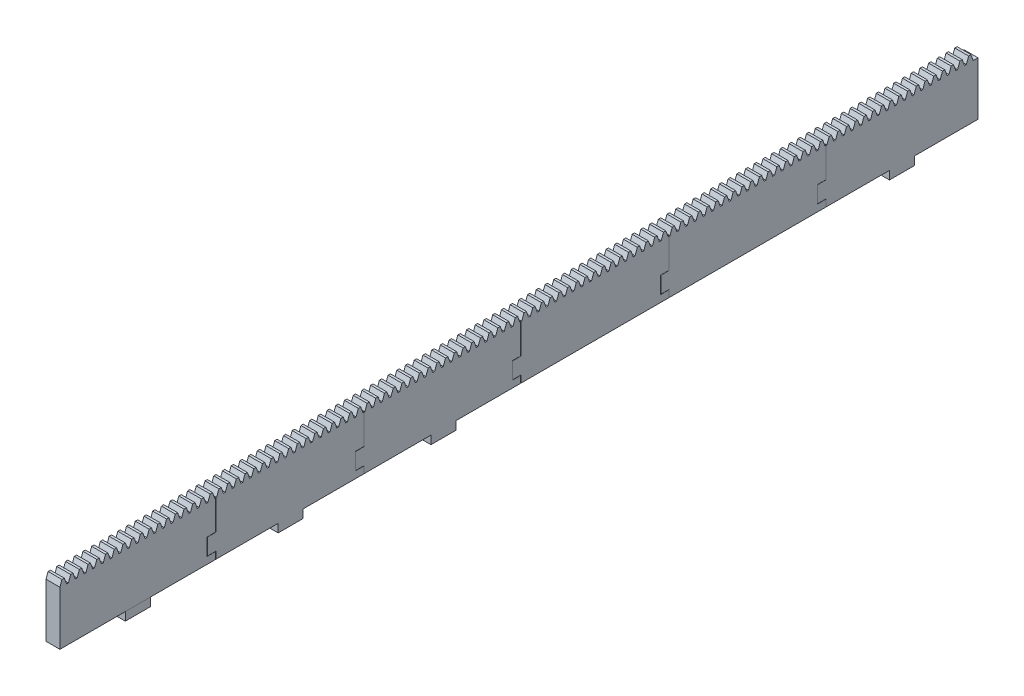
from build123d import *

# Parameters (mm, degrees)
SKETCH_2_W                  = 662
SKETCH_2_H                  = 38.37525226
EXTRUDE_1_DEPTH             = 10
EXTRUDE_2_DEPTH             = 10
PATTERN_LINEAR_1_COUNT      = 105
PATTERN_LINEAR_1_PITCH      = 6.283185307
SKETCH_8530_W               = 20
SKETCH_8530_H               = 8
EXTRUDE_8540_DEPTH          = 22
CUT_EXTRUDE_5_DEPTH         = 90936.510107105
CUT_EXTRUDE_5_DEPTH_BACK    = 90936.510107105
SKETCH_8923_R               = 2.75
CUT_EXTRUDE_5_4_3_DEPTH     = 4.3
CUT_EXTRUDE_6_DEPTH         = 90936.510107105
CUT_EXTRUDE_6_DEPTH_BACK    = 90936.510107105
CUT_EXTRUDE_0_15_DEPTH      = 90936.510107105
CUT_EXTRUDE_0_15_DEPTH_BACK = 90936.510107105
SKETCH_9619_W               = 11.96043534
SKETCH_9619_H               = 56
SKETCH_9619_W_2             = 10.15
SKETCH_5_W                  = 10
SKETCH_5_H                  = 18
EXTRUDE_6_DEPTH             = 6
PATTERN_LINEAR_2_COUNT      = 6
PATTERN_LINEAR_2_PITCH      = 110.15229715
SKETCH_6_W                  = 10
SKETCH_6_H                  = 18
EXTRUDE_7_DEPTH             = 6


with BuildPart() as part:
    # Эскиз2 → Бобышка-Вытянуть1 (new body)
    with BuildSketch(Plane(origin=(0, 0, 0), x_dir=(0, 0, -1), z_dir=(1, 0, 0))):
        with Locations((304.45000531, -90914.099555903)):
            Rectangle(SKETCH_2_W, SKETCH_2_H)
    extrude(amount=EXTRUDE_1_DEPTH)

    # Эскиз3 → Бобышка-Вытянуть2 (add)
    with BuildSketch(Plane(origin=(10, 0, 0), x_dir=(0, 0, -1), z_dir=(1, 0, 0))):
        Polygon((-26.54999469, -90894.911929773), (-24.91249469, -90890.411929773), (-23.22649469, -90890.411929773), (-21.58899469, -90894.911929773), align=None)
    extrude_2 = extrude(amount=-EXTRUDE_2_DEPTH)

    # Линейный массив1: Бобышка-Вытянуть2 ×105
    with Locations(*[(0, 0, -i * PATTERN_LINEAR_1_PITCH) for i in range(1, PATTERN_LINEAR_1_COUNT)]):
        add(extrude_2)

    # Sketch 8530 → Extrude 8540 (add)
    with BuildSketch(Plane(origin=(0, 0, 0), x_dir=(0, 0, -1), z_dir=(1, 0, 0))):
        with Locations((580.504612499, -90929.287182033)):
            Rectangle(SKETCH_8530_W, SKETCH_8530_H)
        with Locations((469.160551924, -90929.287182033)):
            Rectangle(SKETCH_8530_W, SKETCH_8530_H)
        with Locations((359.204809048, -90929.287182033)):
            Rectangle(SKETCH_8530_W, SKETCH_8530_H)
        with Locations((249.249066172, -90929.287182033)):
            Rectangle(SKETCH_8530_W, SKETCH_8530_H)
        with Locations((139.293323297, -90929.287182033)):
            Rectangle(SKETCH_8530_W, SKETCH_8530_H)
        with Locations((29.743126748, -90929.287182033)):
            Rectangle(SKETCH_8530_W, SKETCH_8530_H)
    extrude(amount=-EXTRUDE_8540_DEPTH)

    # Sketch 8923 → Болты_рейки_М5 (cut, two sides: drawn at the far end of the back side and taken through both)
    with BuildSketch(Plane(origin=(0, 0, 0), x_dir=(1, 0, 0), z_dir=(0, 1, 0)).offset(-CUT_EXTRUDE_5_DEPTH_BACK)):
        with Locations(Location((-11, 580.504612499, 0), (0, 0, 270))):
            Circle(SKETCH_8923_R)
        with Locations(Location((-11, 469.160551924, 0), (0, 0, 270))):
            Circle(SKETCH_8923_R)
        with Locations(Location((-11, 359.204809048, 0), (0, 0, 270))):
            Circle(SKETCH_8923_R)
        with Locations(Location((-11, 249.249066172, 0), (0, 0, 270))):
            Circle(SKETCH_8923_R)
        with Locations(Location((-11, 139.293323297, 0), (0, 0, 270))):
            Circle(SKETCH_8923_R)
        with Locations(Location((-11, 29.743126748, 0), (0, 0, 270))):
            Circle(SKETCH_8923_R)
    extrude(amount=CUT_EXTRUDE_5_DEPTH + CUT_EXTRUDE_5_DEPTH_BACK, mode=Mode.SUBTRACT)

    # Sketch 8974 → Гайки_рейки_М5_4_3мм (cut)
    with BuildSketch(Plane(origin=(0, -90925.287182033, 0), x_dir=(1, 0, 0), z_dir=(0, 1, 0))):
        Polygon((-6.207992766, 580.504612499), (-8.603996383, 576.354612499), (-13.396003617, 576.354612499), (-15.792007234, 580.504612499), (-13.396003617, 584.654612499), (-8.603996383, 584.654612499), align=None)
        Polygon((-6.207992766, 469.160551924), (-8.603996383, 465.010551924), (-13.396003617, 465.010551924), (-15.792007234, 469.160551924), (-13.396003617, 473.310551924), (-8.603996383, 473.310551924), align=None)
        Polygon((-6.207992766, 359.204809048), (-8.603996383, 355.054809048), (-13.396003617, 355.054809048), (-15.792007234, 359.204809048), (-13.396003617, 363.354809048), (-8.603996383, 363.354809048), align=None)
        Polygon((-6.207992766, 249.249066172), (-8.603996383, 245.099066172), (-13.396003617, 245.099066172), (-15.792007234, 249.249066172), (-13.396003617, 253.399066172), (-8.603996383, 253.399066172), align=None)
        Polygon((-6.207992766, 139.293323297), (-8.603996383, 135.143323297), (-13.396003617, 135.143323297), (-15.792007234, 139.293323297), (-13.396003617, 143.443323297), (-8.603996383, 143.443323297), align=None)
        Polygon((-6.207992766, 29.743126748), (-8.603996383, 25.593126748), (-13.396003617, 25.593126748), (-15.792007234, 29.743126748), (-13.396003617, 33.893126748), (-8.603996383, 33.893126748), align=None)
    extrude(amount=-CUT_EXTRUDE_5_4_3_DEPTH, mode=Mode.SUBTRACT)

    # Sketch 9108 → Секции_рейки_шип_паз_6шт (cut, two sides: drawn at the far end of the back side and taken through both)
    with BuildSketch(Plane(origin=(0, 0, 0), x_dir=(0, 0, -1), z_dir=(1, 0, 0)).offset(-CUT_EXTRUDE_6_DEPTH_BACK)):
        Polygon((525.784219688, -90938.287182033), (525.634219688, -90938.287182033), (525.634219688, -90928.362182033), (519.634219688, -90928.362182033), (519.634219688, -90916.212182033), (525.634219688, -90916.212182033), (525.634219688, -90888.287182033), (525.784219688, -90888.287182033), (525.784219688, -90916.362182033), (519.784219688, -90916.362182033), (519.784219688, -90928.212182033), (525.784219688, -90928.212182033), align=None)
        Polygon((412.686884159, -90938.287182033), (412.536884159, -90938.287182033), (412.536884159, -90928.362182033), (406.536884159, -90928.362182033), (406.536884159, -90916.212182033), (412.536884159, -90916.212182033), (412.536884159, -90888.287182033), (412.686884159, -90888.287182033), (412.686884159, -90916.362182033), (406.686884159, -90916.362182033), (406.686884159, -90928.212182033), (412.686884159, -90928.212182033), align=None)
        Polygon((305.872733937, -90938.287182033), (305.722733937, -90938.287182033), (305.722733937, -90928.362182033), (299.722733937, -90928.362182033), (299.722733937, -90916.212182033), (305.722733937, -90916.212182033), (305.722733937, -90888.287182033), (305.872733937, -90888.287182033), (305.872733937, -90916.362182033), (299.872733937, -90916.362182033), (299.872733937, -90928.212182033), (305.872733937, -90928.212182033), align=None)
        Polygon((192.775398408, -90938.287182033), (192.625398408, -90938.287182033), (192.625398408, -90928.362182033), (186.625398408, -90928.362182033), (186.625398408, -90916.212182033), (192.625398408, -90916.212182033), (192.625398408, -90888.287182033), (192.775398408, -90888.287182033), (192.775398408, -90916.362182033), (186.775398408, -90916.362182033), (186.775398408, -90928.212182033), (192.775398408, -90928.212182033), align=None)
        Polygon((85.961248186, -90938.287182033), (85.811248186, -90938.287182033), (85.811248186, -90928.362182033), (79.811248186, -90928.362182033), (79.811248186, -90916.212182033), (85.811248186, -90916.212182033), (85.811248186, -90888.287182033), (85.961248186, -90888.287182033), (85.961248186, -90916.362182033), (79.961248186, -90916.362182033), (79.961248186, -90928.212182033), (85.961248186, -90928.212182033), align=None)
    extrude(amount=CUT_EXTRUDE_6_DEPTH + CUT_EXTRUDE_6_DEPTH_BACK, mode=Mode.SUBTRACT)


with BuildPart() as cut_extrude_6_piece_1:
    # of the separate pieces the step leaves, piece 1, a body of its own (cut_extrude_6_pieces)
    add(part.part.solids().sort_by_distance((10, -90933.287182033, -412.686884159))[0])


with BuildPart() as cut_extrude_6_piece_2:
    # of the separate pieces the step leaves, piece 2, a body of its own (cut_extrude_6_pieces)
    add(part.part.solids().sort_by_distance((10, -90933.287182033, -192.775398408))[0])


with BuildPart() as cut_extrude_6_piece_3:
    # of the separate pieces the step leaves, piece 3, a body of its own (cut_extrude_6_pieces)
    add(part.part.solids().sort_by_distance((10, -90933.287182033, -525.784219688))[0])


with BuildPart() as cut_extrude_6_piece_4:
    # of the separate pieces the step leaves, piece 4, a body of its own (cut_extrude_6_pieces)
    add(part.part.solids().sort_by_distance((0, -90933.287182033, 26.54999469))[0])


with BuildPart() as cut_extrude_6_piece_5:
    # of the separate pieces the step leaves, piece 5, a body of its own (cut_extrude_6_pieces)
    add(part.part.solids().sort_by_distance((10, -90933.287182033, -85.961248186))[0])


with BuildPart() as cut_extrude_6_piece_6:
    # of the separate pieces the step leaves, piece 6, a body of its own (cut_extrude_6_pieces)
    add(part.part.solids().sort_by_distance((10, -90933.287182033, -305.872733937))[0])


with BuildPart() as cut_extrude_0_15_tool:
    # Sketch 9619 → Торцы_рейки_зазор_0_15мм (new, two sides: drawn at the far end of the back side and taken through both)
    with BuildSketch(Plane(origin=(0, 0, 0), x_dir=(0, 0, -1), z_dir=(1, 0, 0)).offset(-CUT_EXTRUDE_0_15_DEPTH_BACK)):
        with Locations((641.28022298, -90911.287182033)):
            Rectangle(SKETCH_9619_W, SKETCH_9619_H)
        with Locations((-31.47499469, -90911.287182033)):
            Rectangle(SKETCH_9619_W_2, SKETCH_9619_H)
    extrude(amount=CUT_EXTRUDE_0_15_DEPTH + CUT_EXTRUDE_0_15_DEPTH_BACK)


with BuildPart() as cut_extrude_6_piece_3_1:
    add(cut_extrude_6_piece_3.part)

    # Торцы_рейки_зазор_0_15мм: cut by cut_extrude_0_15_tool
    add(cut_extrude_0_15_tool.part, mode=Mode.SUBTRACT)

    # Эскиз6 → Бобышка-Вытянуть7 (add)
    with BuildSketch(Plane.XZ.offset(90933.287182033)):
        with Locations((5, -580.504612499)):
            Rectangle(SKETCH_6_W, SKETCH_6_H)
    extrude(amount=EXTRUDE_7_DEPTH)


with BuildPart() as cut_extrude_6_piece_4_1:
    add(cut_extrude_6_piece_4.part)

    # Торцы_рейки_зазор_0_15мм: cut by cut_extrude_0_15_tool
    add(cut_extrude_0_15_tool.part, mode=Mode.SUBTRACT)


with BuildPart() as body_7:
    # Эскиз5 → Бобышка-Вытянуть6 (new body)
    with BuildSketch(Plane.XZ.offset(90933.287182033)):
        with Locations((5, -29.743126748)):
            Rectangle(SKETCH_5_W, SKETCH_5_H)
    extrude_6 = extrude(amount=EXTRUDE_6_DEPTH)


with BuildPart() as cut_extrude_6_piece_2_1:
    add(cut_extrude_6_piece_2.part)

    add(cut_extrude_6_piece_5.part)  # Линейный массив2 merges Секции_рейки_шип_паз_6шт piece 5
    # Линейный массив2: Бобышка-Вытянуть6 ×6, 3 skipped
    with Locations(*[(0, 0, -i * PATTERN_LINEAR_2_PITCH) for i in range(1, PATTERN_LINEAR_2_COUNT) if i not in (3, 4, 5)]):
        add(extrude_6)


solid = Compound([cut_extrude_6_piece_1.part, cut_extrude_6_piece_6.part, cut_extrude_6_piece_3_1.part, cut_extrude_6_piece_4_1.part, body_7.part, cut_extrude_6_piece_2_1.part])
